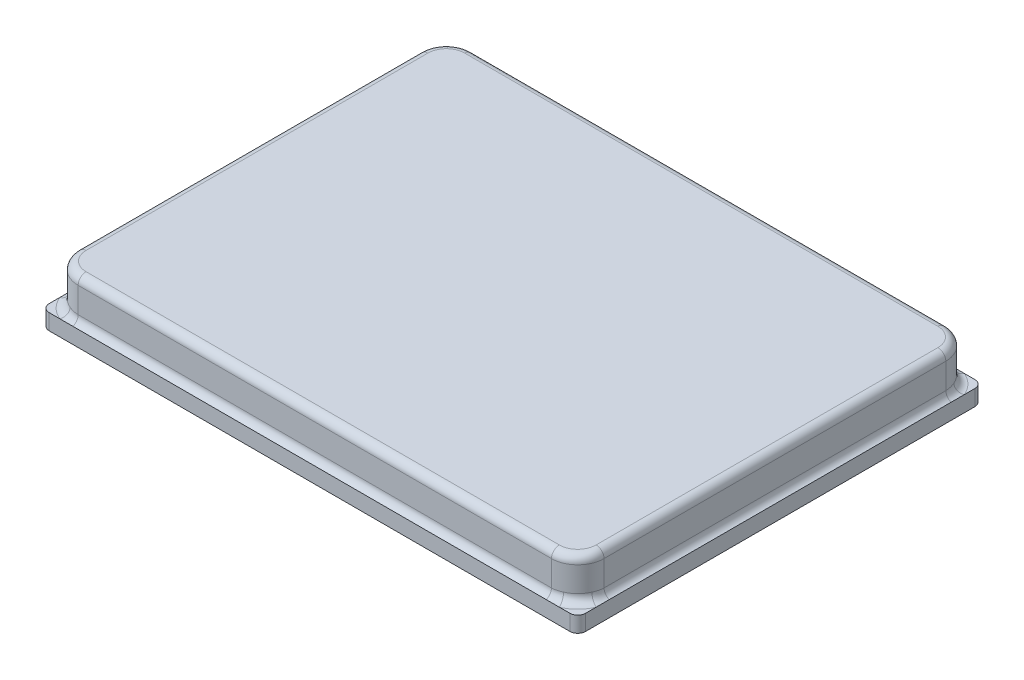
from build123d import *

# Parameters (mm, degrees)
SKETCH1_W           = 200
SKETCH1_H           = 150
SKETCH1_R           = 3
BOSS_EXTRUDE1_DEPTH = 15.5
SKETCH2_W           = 200
SKETCH2_H           = 150
BOSS_EXTRUDE2_DEPTH = 5
SKETCH3_W           = 204
SKETCH3_H           = 154
SKETCH3_W_2         = 189.5
SKETCH3_H_2         = 139.5
BOSS_EXTRUDE3_DEPTH = 5
SKETCH4_W           = 204
SKETCH4_H           = 154
SKETCH4_W_2         = 200
SKETCH4_H_2         = 150
BOSS_EXTRUDE4_DEPTH = 1
FILLET1_R           = 10
FILLET2_R           = 3


with BuildPart() as part:
    # Sketch1 → Boss-Extrude1 (new body)
    with BuildSketch(Plane(origin=(0, 0, 0), x_dir=(1, 0, 0), z_dir=(0, 1, 0))):
        with Locations((100, 75)):
            Rectangle(SKETCH1_W, SKETCH1_H)
        with BuildLine():
            Line((9.846194078, 18.9), (5.25, 18.9))
            Line((5.25, 18.9), (5.25, 131.1))
            Line((5.25, 131.1), (9.846194078, 131.1))
            ThreePointArc((9.846194078, 131.1), (16.248201641, 133.751798359), (18.9, 140.153805922))
            Line((18.9, 140.153805922), (18.9, 144.75))
            Line((18.9, 144.75), (181.1, 144.75))
            Line((181.1, 144.75), (181.1, 140.153805922))
            ThreePointArc((181.1, 140.153805922), (183.751798359, 133.751798359), (190.153805922, 131.1))
            Line((190.153805922, 131.1), (194.75, 131.1))
            Line((194.75, 131.1), (194.75, 18.9))
            Line((194.75, 18.9), (190.153805922, 18.9))
            ThreePointArc((190.153805922, 18.9), (183.751798359, 16.248201641), (181.1, 9.846194078))
            Line((181.1, 9.846194078), (181.1, 5.25))
            Line((181.1, 5.25), (18.9, 5.25))
            Line((18.9, 5.25), (18.9, 9.846194078))
            ThreePointArc((18.9, 9.846194078), (16.248201641, 16.248201641), (9.846194078, 18.9))
        make_face(mode=Mode.SUBTRACT)
        with Locations((9.846194078, 9.846194078)):
            Circle(SKETCH1_R, mode=Mode.SUBTRACT)
        with Locations((190.153805922, 9.846194078)):
            Circle(SKETCH1_R, mode=Mode.SUBTRACT)
        with Locations((190.153805922, 140.153805922)):
            Circle(SKETCH1_R, mode=Mode.SUBTRACT)
        with Locations((9.846194078, 140.153805922)):
            Circle(SKETCH1_R, mode=Mode.SUBTRACT)
    extrude(amount=BOSS_EXTRUDE1_DEPTH)

    # Sketch2 → Boss-Extrude2 (add)
    with BuildSketch(Plane(origin=(0, 15.5, 0), x_dir=(1, 0, 0), z_dir=(0, 1, 0))):
        with Locations((100, 75)):
            Rectangle(SKETCH2_W, SKETCH2_H)
    extrude(amount=BOSS_EXTRUDE2_DEPTH)

    # Sketch3 → Boss-Extrude3 (add)
    with BuildSketch(Plane.XZ):
        with Locations((100, -75)):
            Rectangle(SKETCH3_W, SKETCH3_H)
        with Locations((100, -75)):
            Rectangle(SKETCH3_W_2, SKETCH3_H_2, mode=Mode.SUBTRACT)
    extrude(amount=-BOSS_EXTRUDE3_DEPTH)

    # Sketch4 → Boss-Extrude4 (add)
    with BuildSketch(Plane.XZ):
        with Locations((100, -75)):
            Rectangle(SKETCH4_W, SKETCH4_H)
        with Locations((100, -75)):
            Rectangle(SKETCH4_W_2, SKETCH4_H_2, mode=Mode.SUBTRACT)
    extrude(amount=BOSS_EXTRUDE4_DEPTH)

    # Fillet1
    fillet1_edges = [part.edges().sort_by_distance(p)[0] for p in [
        (200, 12.75, -150),
        (200, 12.75, 0),
        (0, 12.75, -150),
        (0, 12.75, 0),
    ]]
    fillet(fillet1_edges, radius=FILLET1_R)

    # Fillet2
    fillet2_edges = [part.edges().sort_by_distance(p)[0] for p in [
        (197.071067812, 5, -2.928932188),
        (197.071067812, 5, -147.071067812),
        (2.928932188, 5, -147.071067812),
        (2.928932188, 5, -2.928932188),
        (0, 5, -75),
        (100, 5, 0),
        (100, 5, -150),
        (200, 5, -75),
    ]]
    fillet(fillet2_edges, radius=FILLET2_R)
    fillet2_2_edges = [part.edges().sort_by_distance(p)[0] for p in [
        (197.071067812, 20.5, -2.928932188),
        (100, 20.5, 0),
        (2.928932188, 20.5, -2.928932188),
        (0, 20.5, -75),
        (2.928932188, 20.5, -147.071067812),
        (100, 20.5, -150),
        (197.071067812, 20.5, -147.071067812),
        (200, 20.5, -75),
        (-2, 2, 2),
        (202, 2, 2),
        (202, 2, -152),
    ]]
    fillet(fillet2_2_edges, radius=FILLET2_R)


solid = part.part
